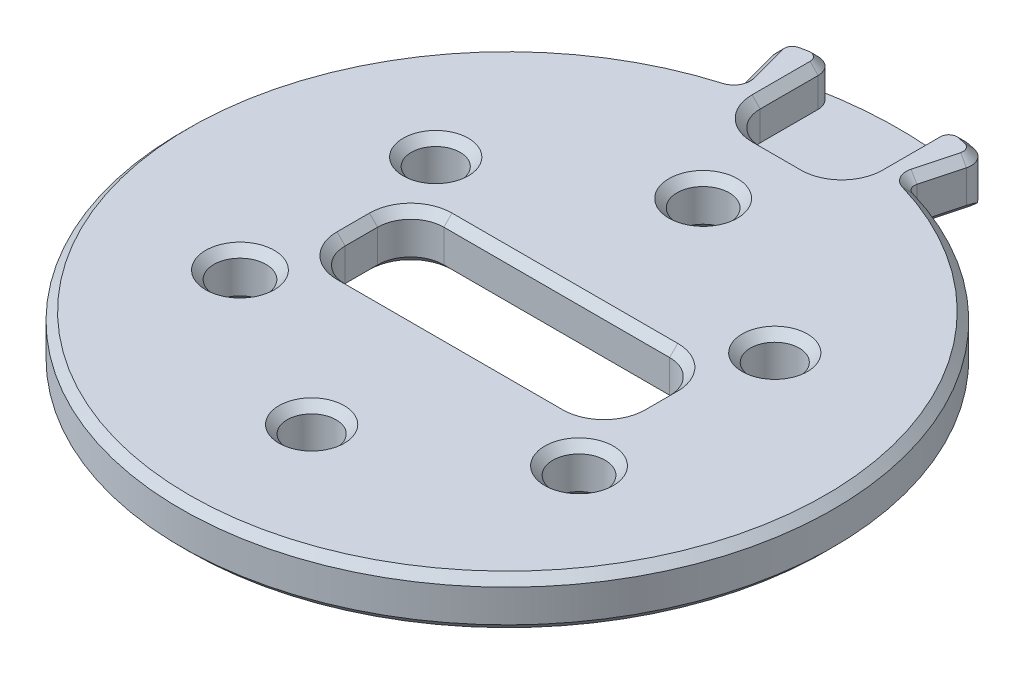
from build123d import *

# Parameters (mm, degrees)
SKETCH_1_R          = 25
EXTRUDE_1_DEPTH     = 3
SKETCH_2_R          = 1.6
SKETCH_2_R_2        = 1.5
CUT_EXTRUDE_1_DEPTH = 3
CUT_EXTRUDE_START   = -3
SKETCH_3_R          = 25
CUT_EXTRUDE_2_DEPTH = 3
FILLET_1_R          = 0.5
SKETCH_4_W          = 17.9
SKETCH_4_H          = 6.05
CUT_EXTRUDE_3_DEPTH = 10
FILLET_3_R          = 2.03
CUT_EXTRUDE_START_2 = -2.3
CUT_EXTRUDE_5_DEPTH = 2.3
FILLET_4_R          = 2
CHAMFER_1_SIZE      = 0.5
FILLET_7_R          = 1
CHAMFER_3_SIZE      = 0.5


with BuildPart() as part:
    # 草图1 → 凸台-拉伸1 (new body)
    with BuildSketch(Plane(origin=(0, 0, 0), x_dir=(1, 0, 0), z_dir=(0, 1, 0))):
        with Locations(Location((0, 0, 0), (0, 0, 270))):
            Circle(SKETCH_1_R)
    extrude(amount=EXTRUDE_1_DEPTH)

    # 草图2 → 切除-拉伸1 (cut)
    with BuildSketch(Plane(origin=(0, 3, 0), x_dir=(1, 0, 0), z_dir=(0, 1, 0))):
        with Locations(Location((10.392304845, -6, 0), (0, 0, 270))):
            Circle(SKETCH_2_R)
        with Locations(Location((-10.392304845, -6, 0), (0, 0, 270))):
            Circle(SKETCH_2_R)
        with Locations(Location((0, 12, 0), (0, 0, 270))):
            Circle(SKETCH_2_R)
        with Locations(Location((0, -12, 0), (0, 0, 270))):
            Circle(SKETCH_2_R_2)
        with Locations(Location((-10.392304845, 6, 0), (0, 0, 270))):
            Circle(SKETCH_2_R_2)
        with Locations(Location((10.392304845, 6, 0), (0, 0, 270))):
            Circle(SKETCH_2_R_2)
    extrude(amount=-CUT_EXTRUDE_1_DEPTH, mode=Mode.SUBTRACT)

    # 草图3 → 切除-拉伸2 (cut)
    with BuildSketch(Plane(origin=(0, 3, 0), x_dir=(1, 0, 0), z_dir=(0, 1, 0)).offset(CUT_EXTRUDE_START)):
        Circle(SKETCH_3_R)
        with BuildLine():
            Line((-6.211657082, 23.182219831), (-5.176380902, 19.318516526))
            ThreePointArc((-5.176380902, 19.318516526), (0, -20), (5.176380902, 19.318516526))
            Line((5.176380902, 19.318516526), (6.211657082, 23.182219831))
            ThreePointArc((6.211657082, 23.182219831), (0, 24), (-6.211657082, 23.182219831))
        make_face(mode=Mode.SUBTRACT)
    extrude(amount=CUT_EXTRUDE_2_DEPTH, mode=Mode.SUBTRACT)

    # 圆角1
    fillet_1_edges = [part.edges().sort_by_distance(p)[0] for p in [
        (5.176380902, 1.5, -19.318516526),
        (-5.176380902, 1.5, -19.318516526),
    ]]
    fillet(fillet_1_edges, radius=FILLET_1_R)

    # 草图4 → 切除-拉伸3 (cut)
    with BuildSketch(Plane(origin=(0, 3, 0), x_dir=(1, 0, 0), z_dir=(0, 1, 0))):
        Rectangle(SKETCH_4_W, SKETCH_4_H)
    extrude(amount=-CUT_EXTRUDE_3_DEPTH, mode=Mode.SUBTRACT)

    # 圆角3
    fillet_3_edges = [part.edges().sort_by_distance(p)[0] for p in [
        (8.95, 1.5, -3.025),
        (8.95, 1.5, 3.025),
        (-8.95, 1.5, 3.025),
        (-8.95, 1.5, -3.025),
    ]]
    fillet(fillet_3_edges, radius=FILLET_3_R)

    # 草图5 → 切除-拉伸5 (cut)
    with BuildSketch(Plane(origin=(0, 3, 0), x_dir=(1, 0, 0), z_dir=(0, 1, 0)).offset(CUT_EXTRUDE_START_2)):
        with BuildLine():
            Line((-3.5, 23.743420141), (-3.5, 17))
            Line((-3.5, 17), (3.5, 17))
            Line((3.5, 17), (3.5, 23.743420141))
            ThreePointArc((3.5, 23.743420141), (0, 24), (-3.5, 23.743420141))
        make_face()
    extrude(amount=CUT_EXTRUDE_5_DEPTH, mode=Mode.SUBTRACT)

    # 圆角4
    fillet_4_edges = [part.edges().sort_by_distance(p)[0] for p in [
        (-3.5, 1.85, -17),
        (3.5, 1.85, -17),
    ]]
    fillet(fillet_4_edges, radius=FILLET_4_R)

    # 倒角1
    chamfer_1_edges = [part.edges().sort_by_distance(p)[0] for p in [
        (-8.355426766, 0, 2.430426766),
        (-8.355426766, 3, -2.430426766),
        (-8.355426766, 0, -2.430426766),
        (0, 0, 10.5),
        (0, 3, 10.5),
        (-10.392304845, 0, 4.4),
        (-10.392304845, 3, 4.4),
        (10.392304845, 0, -7.5),
        (10.392304845, 3, -7.5),
        (-10.392304845, 0, -7.5),
        (-10.392304845, 3, -7.5),
        (10.392304845, 0, 4.4),
        (10.392304845, 3, 4.4),
        (0, 0, -13.6),
        (0, 3, -13.6),
        (0, 0, -24),
        (-5.757934554, 0, -21.488904301),
        (-5.757934554, 3, -21.488904301),
        (0, 3, 20),
        (0, 0, 20),
        (5.757934554, 3, -21.488904301),
        (5.757934554, 0, -21.488904301),
        (5.351145434, 3, -19.421478878),
        (5.351145434, 0, -19.421478878),
        (-5.351145434, 3, -19.421478878),
        (-5.351145434, 0, -19.421478878),
        (8.95, 3, 0),
        (8.95, 0, 0),
        (0, 3, 3.025),
        (0, 0, 3.025),
        (0, 3, -3.025),
        (0, 0, -3.025),
        (-8.95, 3, 0),
        (-8.95, 0, 0),
        (8.355426766, 3, 2.430426766),
        (8.355426766, 0, 2.430426766),
        (8.355426766, 3, -2.430426766),
        (8.355426766, 0, -2.430426766),
        (-8.355426766, 3, 2.430426766),
    ]]
    chamfer(chamfer_1_edges, length=CHAMFER_1_SIZE)

    # 圆角7
    fillet_7_edges = [part.edges().sort_by_distance(p)[0] for p in [
        (-3.5, 1.85, -23.743420141),
        (3.5, 1.85, -23.743420141),
        (-6.211657082, 1.5, -23.182219831),
        (6.211657082, 1.5, -23.182219831),
    ]]
    fillet(fillet_7_edges, radius=FILLET_7_R)

    # 倒角3
    chamfer_3_edges = [part.edges().sort_by_distance(p)[0] for p in [
        (4.947039166, 3, -23.484607799),
        (3.865828168, 3, -23.328679278),
        (3.5, 3, -20.777743569),
        (2.914213562, 3, -17.585786438),
        (0, 3, -17),
        (-2.914213562, 3, -17.585786438),
        (-3.5, 3, -20.777743569),
        (-4.947039166, 3, -23.484607799),
        (-3.865828168, 3, -23.328679278),
        (5.46233374, 3, -23.33079751),
        (-5.46233374, 3, -23.33079751),
    ]]
    chamfer(chamfer_3_edges, length=CHAMFER_3_SIZE - 0.0001)  # a hair under: the kernel refuses the full size


solid = part.part
